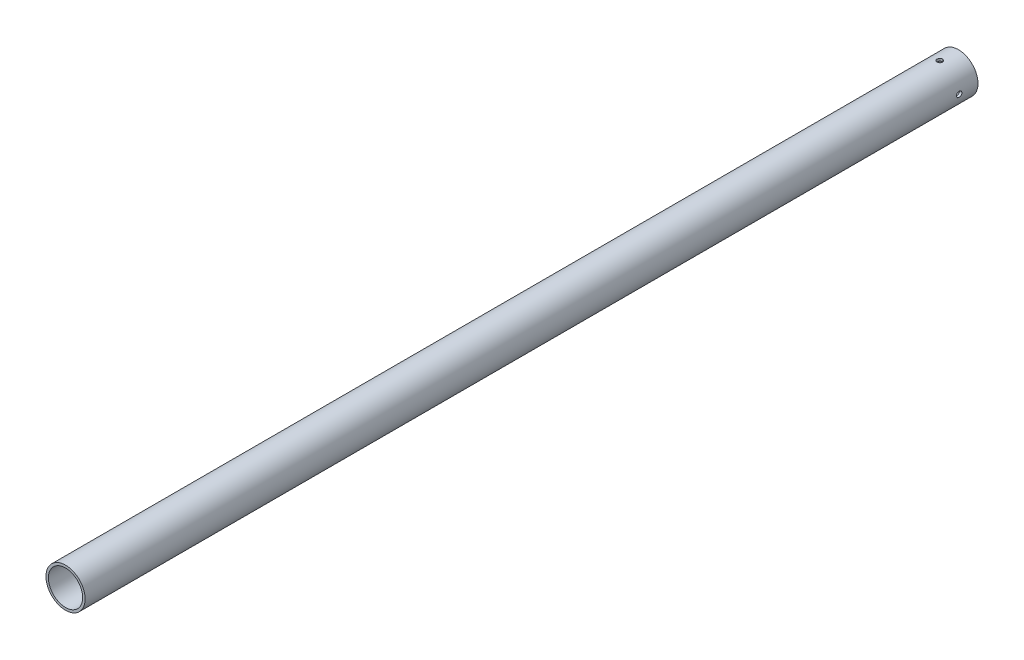
from build123d import *

# Parameters (mm, degrees)
SKETCH2_R               = 12.7
SKETCH2_R_2             = 11.1125
BOSS_EXTRUDE1_DEPTH     = 289.593629981
CUT_EXTRUDE1_DEPTH      = 291.150048295
CUT_EXTRUDE1_DEPTH_BACK = 291.150048295
SKETCH3_R               = 1.7526
CUT_EXTRUDE2_DEPTH      = 291.150048405
CUT_EXTRUDE2_DEPTH_BACK = 291.150048405
SKETCH5_R               = 1.7526


with BuildPart() as part:
    # Sketch2 → Boss-Extrude1 (new, symmetric)
    with BuildSketch(Plane.XY):
        Circle(SKETCH2_R)
        Circle(SKETCH2_R_2, mode=Mode.SUBTRACT)
    extrude(amount=BOSS_EXTRUDE1_DEPTH, both=True)

    # Sketch3 → Cut-Extrude1 (cut, two sides: drawn at the far end of the back side and taken through both)
    with BuildSketch(Plane(origin=(0, 0, 0), x_dir=(1, 0, 0), z_dir=(0, 1, 0)).offset(-CUT_EXTRUDE1_DEPTH_BACK)):
        with Locations((0, 277.401629981)):
            Circle(SKETCH3_R)
    extrude(amount=CUT_EXTRUDE1_DEPTH + CUT_EXTRUDE1_DEPTH_BACK, mode=Mode.SUBTRACT)

    # Sketch5 → Cut-Extrude2 (cut, two sides: drawn at the far end of the back side and taken through both)
    with BuildSketch(Plane(origin=(0, 0, 0), x_dir=(0, 0, -1), z_dir=(1, 0, 0)).offset(-CUT_EXTRUDE2_DEPTH_BACK)):
        with Locations((277.401629981, 0)):
            Circle(SKETCH5_R)
    extrude(amount=CUT_EXTRUDE2_DEPTH + CUT_EXTRUDE2_DEPTH_BACK, mode=Mode.SUBTRACT)


solid = part.part
